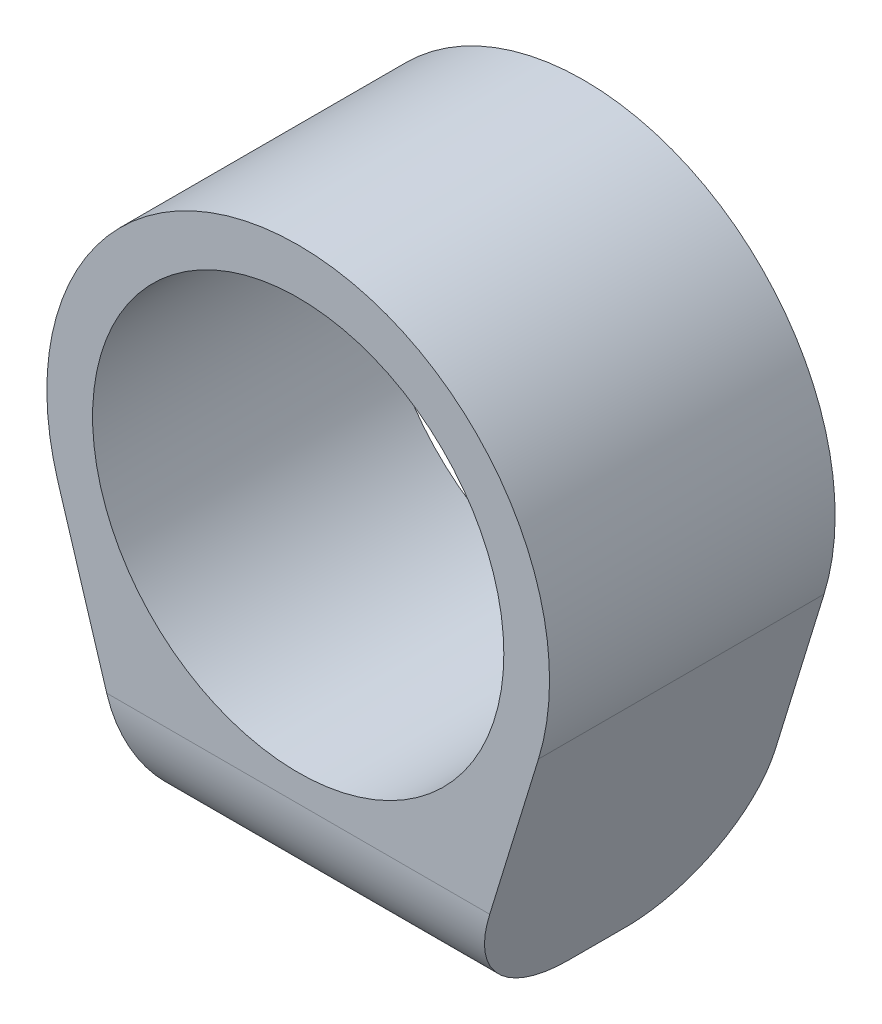
from build123d import *

# Parameters (mm, degrees)
SKETCH1_R           = 18
BOSS_EXTRUDE1_DEPTH = 25
CUT_EXTRUDE1_DEPTH  = 10
FILLET1_R           = 10


with BuildPart() as part:
    # Sketch1 → Boss-Extrude1 (new body)
    with BuildSketch(Plane.XY):
        with BuildLine():
            Line((-21.031401564, -6.456016438), (-13.695019248, -30.355336397))
            Line((-13.695019248, -30.355336397), (13.695019248, -30.355336397))
            Line((13.695019248, -30.355336397), (21.031401564, -6.456016438))
            ThreePointArc((21.031401564, -6.456016438), (0, 22), (-21.031401564, -6.456016438))
        make_face()
        Circle(SKETCH1_R, mode=Mode.SUBTRACT)
    extrude(amount=BOSS_EXTRUDE1_DEPTH)

    # Sketch2 → Cut-Extrude1 (cut)
    with BuildSketch(Plane.XZ.offset(30.355336397)):
        with BuildLine():
            Line((-7, 12.5), (-4.5, 12.5))
            Line((-4.5, 12.5), (-2, 12.5))
            ThreePointArc((-2, 12.5), (-4.5, 15), (-7, 12.5))
        make_face()
        with BuildLine():
            Line((-2, 12.5), (-4.5, 12.5))
            Line((-4.5, 12.5), (-7, 12.5))
            ThreePointArc((-7, 12.5), (-4.5, 10), (-2, 12.5))
        make_face()
        with BuildLine():
            ThreePointArc((7, 12.5), (4.5, 15), (2, 12.5))
            Line((2, 12.5), (4.5, 12.5))
            Line((4.5, 12.5), (7, 12.5))
        make_face()
        with BuildLine():
            Line((4.5, 12.5), (2, 12.5))
            ThreePointArc((2, 12.5), (4.5, 10), (7, 12.5))
            Line((7, 12.5), (4.5, 12.5))
        make_face()
    extrude(amount=-CUT_EXTRUDE1_DEPTH, mode=Mode.SUBTRACT)

    # Fillet1
    fillet1_edges = [part.edges().sort_by_distance(p)[0] for p in [
        (0, -30.355336397, 25),
        (0, -30.355336397, 0),
    ]]
    fillet(fillet1_edges, radius=FILLET1_R - 0.0001)  # a hair under: the kernel refuses the full size


solid = part.part
